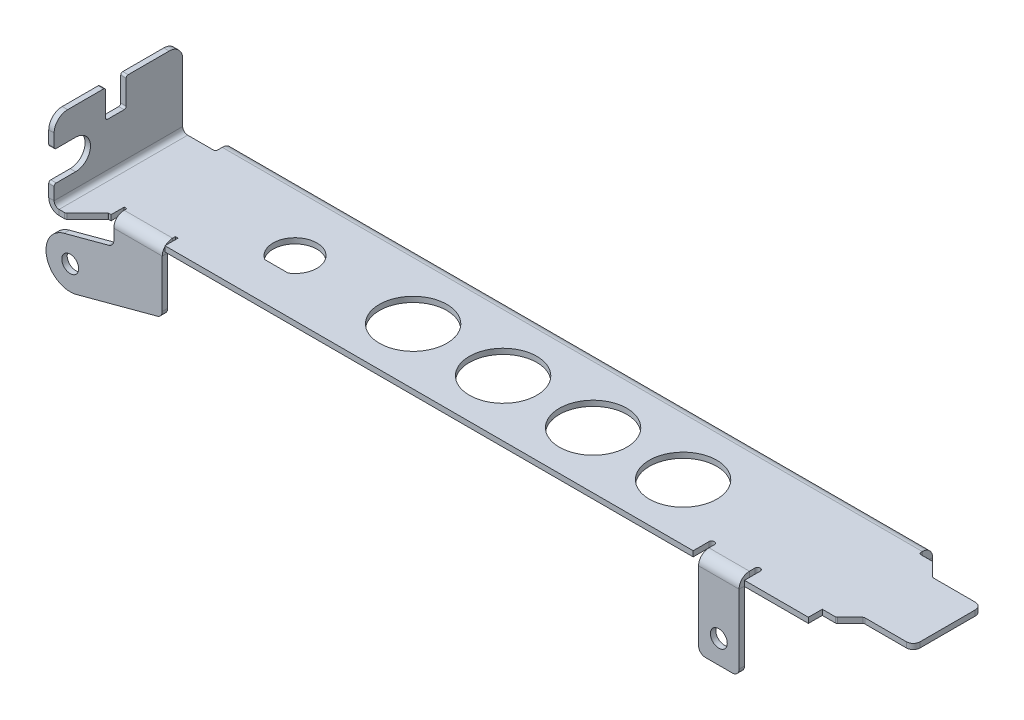
from build123d import *

# Parameters (mm, degrees)
BASE_FLANGE1_DEPTH            = 0.8
EDGE_FLANGE1_STRIP_W          = 4.6732
EDGE_FLANGE1_STRIP_H          = 0.8
EDGE_FLANGE1_STRIP_CUT_DEPTH  = 19.05
EDGE_FLANGE1_DEPTH            = 19.05
EDGE_FLANGE1_START            = 0.8
EDGE_FLANGE1_FLAT_DEPTH       = 0.8
CHAMFER2_SIZE                 = 3.17
EDGE_FLANGE2_START            = -1.5366
EDGE_FLANGE2_DEPTH            = 2.5366
EDGE_FLANGE2_START_2          = -0.084496
EDGE_FLANGE2_2_OUTLINE_W      = 6
EDGE_FLANGE2_2_OUTLINE_H      = 0.8
EDGE_FLANGE2_2_DEPTH          = 1.084496
EDGE_FLANGE2_START_3          = -12.8
EDGE_FLANGE2_3_OUTLINE_W      = 6
EDGE_FLANGE2_3_OUTLINE_H      = 0.8
EDGE_FLANGE2_3_DEPTH          = 11.2634
EDGE_FLANGE2_START_4          = -27.694130054
EDGE_FLANGE2_4_DEPTH          = 6
EDGE_FLANGE2_5_DEPTH          = 6
EDGE_FLANGE4_STRIP_W          = 4.6732
EDGE_FLANGE4_STRIP_H          = 0.8
EDGE_FLANGE4_STRIP_CUT_DEPTH  = 7.17999872
EDGE_FLANGE4_RELIEF_W         = 5.0732
EDGE_FLANGE4_RELIEF_H         = 0.4
EDGE_FLANGE4_RELIEF_CUT_DEPTH = 0.8
EDGE_FLANGE4_DEPTH            = 7.17999872
EDGE_FLANGE4_FLAT_DEPTH       = 0.8
M3X0_5_TAPPED_HOLE1_D         = 2.5
EDGE_FLANGE3_STRIP_W          = 4.6732
EDGE_FLANGE3_STRIP_H          = 0.8
EDGE_FLANGE3_STRIP_CUT_DEPTH  = 103.732625794
EDGE_FLANGE3_DEPTH            = 103.732625794
SKETCH21_R                    = 5
CUT_EXTRUDE1_DEPTH            = 126.679221242
FILLET1_R                     = 1
FILLET3_R                     = 2
FILLET4_R                     = 0.3
FILLET5_R                     = 1


with BuildPart() as part:
    # Base-Flange1: sheet metal written as solids
    # Sketch2 → Base-Flange1 (new body)
    with BuildSketch(Plane(origin=(0, 0, 0), x_dir=(1, 0, 0), z_dir=(0, 1, 0))):
        Polygon((-115.1509, -12.3825), (-120.015, -12.3825), (-120.015, 6.6675), (-115.1509, 6.6675), (-115.1509, 9.2075), (-11.418274206, 9.2075), (-11.418274206, 7.1501), (-9.360874206, 7.1501), (-7.303474206, 5.0927), (0, 5.0927), (0, -5.0927), (-7.303474206, -5.0927), (-9.360874206, -7.1501), (-11.418274206, -7.1501), (-11.418274206, -9.2075), (-115.1509, -9.2075), align=None)
    extrude(amount=-BASE_FLANGE1_DEPTH)

    # Edge-Flange1: sheet metal written as solids
    # Edge-Flange1 strip (on a plane across the edge) → Edge-Flange1 strip cut (cut)
    with BuildSketch(Plane(origin=(-120.015, 0, -6.6675), x_dir=(1, 0, 0), z_dir=(0, 0, 1))):
        with Locations((-1.6, -0.4)):
            Rectangle(EDGE_FLANGE1_STRIP_W, EDGE_FLANGE1_STRIP_H)
    extrude(amount=EDGE_FLANGE1_STRIP_CUT_DEPTH, mode=Mode.SUBTRACT)

    # Edge-Flange1 bend section (on a plane across the edge) → Edge-Flange1 (add)
    with BuildSketch(Plane(origin=(-120.015, 0, -6.6675), x_dir=(1, 0, 0), z_dir=(0, 0, 1))):
        with BuildLine():
            Line((-0.8, 0.7366), (0, 0.7366))
            ThreePointArc((0, 0.7366), (0.215745145, 0.215745145), (0.7366, 0))
            Line((0.7366, 0), (0.7366, -0.8))
            ThreePointArc((0.7366, -0.8), (-0.34994028, -0.34994028), (-0.8, 0.7366))
        make_face()
    extrude(amount=EDGE_FLANGE1_DEPTH)

    # Edge-Flange1 profile (on flange) → Edge-Flange1 flat (add)
    with BuildSketch(Plane.ZY.offset(120.015).offset(EDGE_FLANGE1_START)):
        with BuildLine():
            ThreePointArc((9.2075, 2.8702), (6.9977, 5.08), (9.2075, 7.2898))
            Line((9.2075, 7.2898), (12.3825, 7.2898))
            Line((12.3825, 7.2898), (12.3825, 11.43))
            Line((12.3825, 11.43), (4.7625, 11.43))
            Line((4.7625, 11.43), (4.7625, 7.239))
            Line((4.7625, 7.239), (1.7145, 7.239))
            Line((1.7145, 7.239), (1.7145, 11.43))
            Line((1.7145, 11.43), (-6.6675, 11.43))
            Line((-6.6675, 11.43), (-6.6675, 0.7366))
            Line((-6.6675, 0.7366), (12.3825, 0.7366))
            Line((12.3825, 0.7366), (12.3825, 2.8702))
            Line((12.3825, 2.8702), (9.2075, 2.8702))
        make_face()
    extrude(amount=-EDGE_FLANGE1_FLAT_DEPTH)

    # Chamfer2
    chamfer2_edges = [part.edges().sort_by_distance(p)[0] for p in [
        (-115.1509, -0.4, 12.3825),
    ]]
    chamfer(chamfer2_edges, length=CHAMFER2_SIZE)

    # Edge-Flange2: read off the stored shape, not the designer's step
    # Edge-Flange2 outline → Edge-Flange2 (cut)
    with BuildSketch(Plane(origin=(0, 0, 0), x_dir=(1, 0, 0), z_dir=(0, 1, 0)).offset(EDGE_FLANGE2_START)):
        with BuildLine():
            Line((-28.494130054, -9.2075), (-27.694130054, -9.2075))
            Line((-27.694130054, -9.2075), (-27.694130054, -6.8709))
            ThreePointArc((-27.694130054, -6.8709), (-28.094130054, -6.4709), (-28.494130054, -6.8709))
            Line((-28.494130054, -6.8709), (-28.494130054, -9.2075))
        make_face()
        with BuildLine():
            Line((-21.694130054, -6.8709), (-21.694130054, -9.2075))
            Line((-21.694130054, -9.2075), (-20.894130054, -9.2075))
            Line((-20.894130054, -9.2075), (-20.894130054, -6.8709))
            ThreePointArc((-20.894130054, -6.8709), (-21.294130054, -6.4709), (-21.694130054, -6.8709))
        make_face()
    extrude(amount=EDGE_FLANGE2_DEPTH, mode=Mode.SUBTRACT)

    # Edge-Flange2 2 outline → Edge-Flange2 2 (cut)
    with BuildSketch(Plane(origin=(0, 0, 0), x_dir=(1, 0, 0), z_dir=(0, 1, 0)).offset(EDGE_FLANGE2_START_2)):
        with Locations((-24.694130054, -8.8075)):
            Rectangle(EDGE_FLANGE2_2_OUTLINE_W, EDGE_FLANGE2_2_OUTLINE_H)
    extrude(amount=EDGE_FLANGE2_2_DEPTH, mode=Mode.SUBTRACT)

    # Edge-Flange2 4 outline → Edge-Flange2 4 (cut)
    with BuildSketch(Plane.YZ.offset(EDGE_FLANGE2_START_4)):
        with BuildLine():
            Line((-0.8, 9.2075), (-0.8, 9.019439951))
            ThreePointArc((-0.8, 9.019439951), (-0.215048049, 8.454889796), (0, 7.6709))
            Line((0, 7.6709), (0, 8.4075))
            Line((0, 8.4075), (-0.084496, 8.4075))
            Line((-0.084496, 8.4075), (-0.084496, 9.2075))
            Line((-0.084496, 9.2075), (-0.8, 9.2075))
        make_face()
    extrude(amount=EDGE_FLANGE2_4_DEPTH, mode=Mode.SUBTRACT)



with BuildPart() as body_2:
    # Edge-Flange2 3 outline → Edge-Flange2 3 (new body)
    with BuildSketch(Plane(origin=(0, 0, 0), x_dir=(1, 0, 0), z_dir=(0, 1, 0)).offset(EDGE_FLANGE2_START_3)):
        with Locations((-24.694130054, -8.8075)):
            Rectangle(EDGE_FLANGE2_3_OUTLINE_W, EDGE_FLANGE2_3_OUTLINE_H)
    extrude(amount=EDGE_FLANGE2_3_DEPTH)


with BuildPart() as part_1:
    add(part.part)

    add(body_2.part)  # Edge-Flange2 5 merges body 2
    # Edge-Flange2 5 outline → Edge-Flange2 5 (add)
    with BuildSketch(Plane.YZ.offset(EDGE_FLANGE2_START_4)):
        with BuildLine():
            ThreePointArc((-0.8, 9.019439951), (-1.156486155, 9.159742848), (-1.5366, 9.2075))
            Line((-1.5366, 9.2075), (-1.5366, 8.4075))
            ThreePointArc((-1.5366, 8.4075), (-1.015745145, 8.191754855), (-0.8, 7.6709))
            Line((-0.8, 7.6709), (-0.8, 9.019439951))
        make_face()
    extrude(amount=EDGE_FLANGE2_5_DEPTH)

    # Edge-Flange4: sheet metal written as solids
    # Edge-Flange4 strip (on a plane across the edge) → Edge-Flange4 strip cut (cut)
    with BuildSketch(Plane(origin=(-107.17090128, -0.8, 9.2075), x_dir=(0, 0, -1), z_dir=(-1, 0, 0))):
        with Locations((-0.8, -0.4)):
            Rectangle(EDGE_FLANGE4_STRIP_W, EDGE_FLANGE4_STRIP_H)
    extrude(amount=EDGE_FLANGE4_STRIP_CUT_DEPTH, mode=Mode.SUBTRACT)

    # Edge-Flange4 relief (on the sheet) → Edge-Flange4 relief cut (cut)
    with BuildSketch(Plane(origin=(-107.17090128, -0.8, 7.6709), x_dir=(0, 0, -1), z_dir=(0, -1, 0))):
        with Locations((-2.1366, 0.2)):
            Rectangle(EDGE_FLANGE4_RELIEF_W, EDGE_FLANGE4_RELIEF_H)
        with Locations((-2.1366, -7.37999872)):
            Rectangle(EDGE_FLANGE4_RELIEF_W, EDGE_FLANGE4_RELIEF_H)
    extrude(amount=-EDGE_FLANGE4_RELIEF_CUT_DEPTH, mode=Mode.SUBTRACT)

    # Edge-Flange4 bend section (on a plane across the edge) → Edge-Flange4 (add)
    with BuildSketch(Plane(origin=(-107.17090128, -0.8, 9.2075), x_dir=(0, 0, -1), z_dir=(-1, 0, 0))):
        with BuildLine():
            Line((0, 0.7366), (0.8, 0.7366))
            ThreePointArc((0.8, 0.7366), (1.015745145, 0.215745145), (1.5366, 0))
            Line((1.5366, 0), (1.5366, -0.8))
            ThreePointArc((1.5366, -0.8), (0.45005972, -0.34994028), (0, 0.7366))
        make_face()
    extrude(amount=EDGE_FLANGE4_DEPTH)

    # Edge-Flange4 profile (on flange) → Edge-Flange4 flat (add)
    with BuildSketch(Plane(origin=(0, -0.8, 9.2075), x_dir=(-1, 0, 0), z_dir=(0, 0, 1))):
        with BuildLine():
            ThreePointArc((121.735691381, 5.082325102), (124.274204272, 9.479158406), (119.877370968, 12.017671298))
            Line((119.877370968, 12.017671298), (107.17090128, 8.612983007))
            Line((107.17090128, 8.612983007), (107.17090128, 0.7366))
            Line((107.17090128, 0.7366), (114.3509, 0.7366))
            Line((114.3509, 0.7366), (114.3509, 3.103576215))
            Line((114.3509, 3.103576215), (121.735691381, 5.082325102))
        make_face()
    extrude(amount=-EDGE_FLANGE4_FLAT_DEPTH)

    # M3x0.5 Tapped Hole1 (through all)
    with Locations(Plane.XY.offset(9.2075)):
        with Locations((-120.806531174, -9.3499982), (-24.694130054, -9.36023907)):
            Hole(M3X0_5_TAPPED_HOLE1_D / 2)

    # Edge-Flange3: sheet metal written as solids
    # Edge-Flange3 strip (on a plane across the edge) → Edge-Flange3 strip cut (cut)
    with BuildSketch(Plane(origin=(-115.1509, -0.8, -9.2075), x_dir=(0, 0, 1), z_dir=(1, 0, 0))):
        with Locations((-0.8, -0.4)):
            Rectangle(EDGE_FLANGE3_STRIP_W, EDGE_FLANGE3_STRIP_H)
    extrude(amount=EDGE_FLANGE3_STRIP_CUT_DEPTH, mode=Mode.SUBTRACT)

    # Edge-Flange3 section (on a plane across the edge) → Edge-Flange3 (add)
    with BuildSketch(Plane(origin=(-115.1509, -0.8, -9.2075), x_dir=(0, 0, 1), z_dir=(1, 0, 0))):
        with BuildLine():
            Line((0, 0.7366), (0, 1.8))
            Line((0, 1.8), (0.8, 1.8))
            Line((0.8, 1.8), (0.8, 0.7366))
            ThreePointArc((0.8, 0.7366), (1.015745145, 0.215745145), (1.5366, 0))
            Line((1.5366, 0), (1.5366, -0.8))
            ThreePointArc((1.5366, -0.8), (0.45005972, -0.34994028), (0, 0.7366))
        make_face()
    extrude(amount=EDGE_FLANGE3_DEPTH)

    # Sketch21 → Cut-Extrude1 (cut, through all)
    with BuildSketch(Plane(origin=(0, 0, 0), x_dir=(1, 0, 0), z_dir=(0, 1, 0))):
        with Locations(Location((-78.363042127, -0.838303057, 0), (0, 0, 270))):
            Circle(SKETCH21_R)
        with Locations(Location((-65.028050672, -0.838303057, 0), (0, 0, 270))):
            Circle(SKETCH21_R)
        with Locations(Location((-51.693043958, -0.838303057, 0), (0, 0, 270))):
            Circle(SKETCH21_R)
        with Locations(Location((-38.358052503, -0.838303057, 0), (0, 0, 270))):
            Circle(SKETCH21_R)
        with BuildLine():
            Line((-97.595092935, -3.588303057), (-94.13099132, -3.588303057))
            ThreePointArc((-94.13099132, -3.588303057), (-95.863042127, 2.411696943), (-97.595092935, -3.588303057))
        make_face()
    extrude(amount=-CUT_EXTRUDE1_DEPTH, mode=Mode.SUBTRACT)

    # Fillet1
    fillet1_edges = [part_1.edges().sort_by_distance(p)[0] for p in [
        (0, -0.4, -5.0927),
        (0, -0.4, 5.0927),
    ]]
    fillet(fillet1_edges, radius=FILLET1_R)

    # Fillet3
    fillet3_edges = [part_1.edges().sort_by_distance(p)[0] for p in [
        (-120.415, 11.43, -6.6675),
        (-120.415, 11.43, 12.3825),
    ]]
    fillet(fillet3_edges, radius=FILLET3_R)

    # Fillet4
    # the kernel refuses this fillet: 0.3 mm, written as the material it adds along each edge
    with BuildSketch(Plane(origin=(-115.1509, 0, -6.6675), x_dir=(-1, 0, 0), z_dir=(0, -1, 0))) as fillet4_piece_1:
        with BuildLine():
            CenterArc((FILLET4_R, FILLET4_R), FILLET4_R, 180, 90)
            Line((0, FILLET4_R), (0, 0))
            Line((0, 0), (FILLET4_R, 0))
        make_face()
    extrude(amount=0.8)
    with BuildSketch(Plane(origin=(-11.418274206, 0, -7.1501), x_dir=(1, 0, 0), z_dir=(0, -1, 0)), Plane(origin=(-120.815, 7.239, 4.7625), x_dir=(0, 1, 0), z_dir=(1, 0, 0)), Plane(origin=(-120.815, 7.239, 1.7145), x_dir=(0, 0, 1), z_dir=(1, 0, 0))) as fillet4_piece_2:
        with BuildLine():
            CenterArc((FILLET4_R, -FILLET4_R), FILLET4_R, 90, 90)
            Line((0, -FILLET4_R), (0, 0))
            Line((0, 0), (FILLET4_R, 0))
        make_face()
    extrude(amount=0.8)
    with BuildSketch(Plane(origin=(-7.303474206, 0, -5.0927), x_dir=(1, 0, 0), z_dir=(0, -1, 0))) as fillet4_piece_3:
        with BuildLine():
            CenterArc((FILLET4_R * 0.414213562373, -FILLET4_R), FILLET4_R, 90, 45)
            Line((-FILLET4_R * 0.292893218813, -FILLET4_R * 0.292893218813), (0, 0))
            Line((0, 0), (FILLET4_R * 0.414213562373, 0))
        make_face()
    extrude(amount=0.8)
    with BuildSketch(Plane(origin=(-7.303474206, 0, 5.0927), x_dir=(1, 0, 0), z_dir=(0, -1, 0))) as fillet4_piece_4:
        with BuildLine():
            CenterArc((FILLET4_R * 0.414213562373, FILLET4_R), FILLET4_R, 225, 45)
            Line((-FILLET4_R * 0.292893218813, FILLET4_R * 0.292893218813), (0, 0))
            Line((0, 0), (FILLET4_R * 0.414213562373, 0))
        make_face()
    extrude(amount=0.8)
    # the kernel refuses this fillet: 0.3 mm, written as the material it takes off along each edge
    with BuildSketch(Plane(origin=(-115.1509, 0.1059659, 9.2125), x_dir=(-0.7071067811864428, 0, 0.7071067811866523), z_dir=(0, -1, 0))) as fillet4_2_piece_1:
        with BuildLine():
            CenterArc((0.04238636, 0.3), FILLET4_R, 261.194947533, 8.805052467)
            Line((-0.003535534, 0.003535534), (0, 0))
            Line((0, 0), (0.04238636, 0))
        make_face()
    extrude(amount=1.0119318, mode=Mode.SUBTRACT)
    with BuildSketch(Plane(origin=(-9.360874206, 0.310660172, 7.1501), x_dir=(-1, 0, 0), z_dir=(0, -1, 0)), Plane(origin=(-118.3209, 0.310660172, 12.3825), x_dir=(-1, 0, 0), z_dir=(0, -1, 0))) as fillet4_2_piece_2:
        with BuildLine():
            CenterArc((FILLET4_R * 0.414213562373, FILLET4_R), FILLET4_R, 225, 45)
            Line((-FILLET4_R * 0.292893218813, FILLET4_R * 0.292893218813), (0, 0))
            Line((0, 0), (FILLET4_R * 0.414213562373, 0))
        make_face()
    extrude(amount=1.421320344, mode=Mode.SUBTRACT)
    with BuildSketch(Plane(origin=(-121.565, 2.8702, 12.3825), x_dir=(0, 0, -1), z_dir=(1, 0, 0)), Plane(origin=(-121.565, 7.2898, 12.3825), x_dir=(0, 1, 0), z_dir=(1, 0, 0)), Plane(origin=(-121.565, 11.43, 4.7625), x_dir=(0, -1, 0), z_dir=(1, 0, 0)), Plane(origin=(-121.565, 11.43, 1.7145), x_dir=(0, 0, -1), z_dir=(1, 0, 0))) as fillet4_2_piece_3:
        with BuildLine():
            CenterArc((FILLET4_R, -FILLET4_R), FILLET4_R, 90, 90)
            Line((0, -FILLET4_R), (0, 0))
            Line((0, 0), (FILLET4_R, 0))
        make_face()
    extrude(amount=2.3, mode=Mode.SUBTRACT)

    # Fillet5
    fillet5_edges = [part_1.edges().sort_by_distance(p)[0] for p in [
        (-21.694130054, -12.8, 8.8075),
        (-27.694130054, -12.8, 8.8075),
        (-107.17090128, -9.412983007, 8.8075),
        (-114.3509, -3.903576215, 8.8075),
    ]]
    fillet(fillet5_edges, radius=FILLET5_R)


solid = part_1.part
